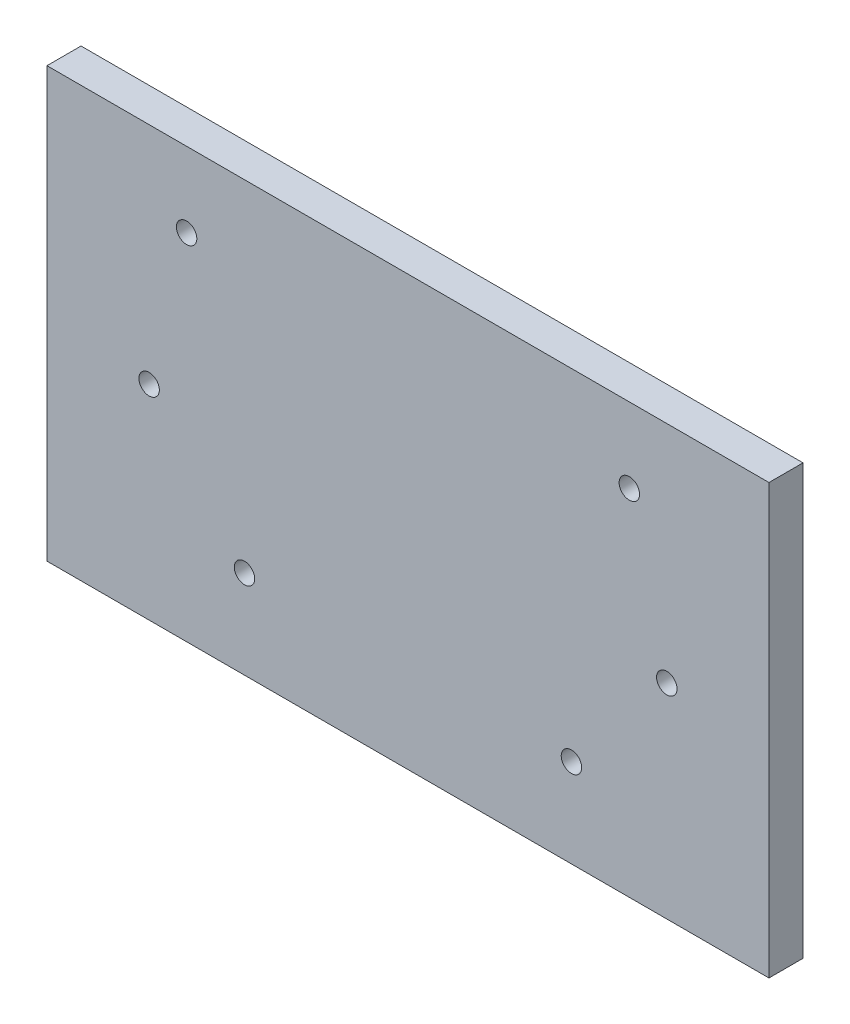
from build123d import *

# Parameters (mm, degrees)
SKETCH1_W           = 106
SKETCH1_H           = 63
BOSS_EXTRUDE1_DEPTH = 5
SKETCH2_R           = 1.5
CUT_EXTRUDE2_DEPTH  = 62.85668921


with BuildPart() as part:
    # Sketch1 → Boss-Extrude1 (new body)
    with BuildSketch(Plane.XY):
        Rectangle(SKETCH1_W, SKETCH1_H)
    extrude(amount=BOSS_EXTRUDE1_DEPTH)

    # Sketch2 → Cut-Extrude2 (cut, through all)
    with BuildSketch(Plane.XY):
        with Locations((-24, -18.5)):
            Circle(SKETCH2_R)
        with Locations((24, -18.5)):
            Circle(SKETCH2_R)
        with Locations((-38, -1.5)):
            Circle(SKETCH2_R)
        with Locations((38, -1.5)):
            Circle(SKETCH2_R)
        with Locations((-32.5, 20.5)):
            Circle(SKETCH2_R)
        with Locations((32.5, 20.5)):
            Circle(SKETCH2_R)
    extrude(amount=CUT_EXTRUDE2_DEPTH, mode=Mode.SUBTRACT)


solid = part.part
